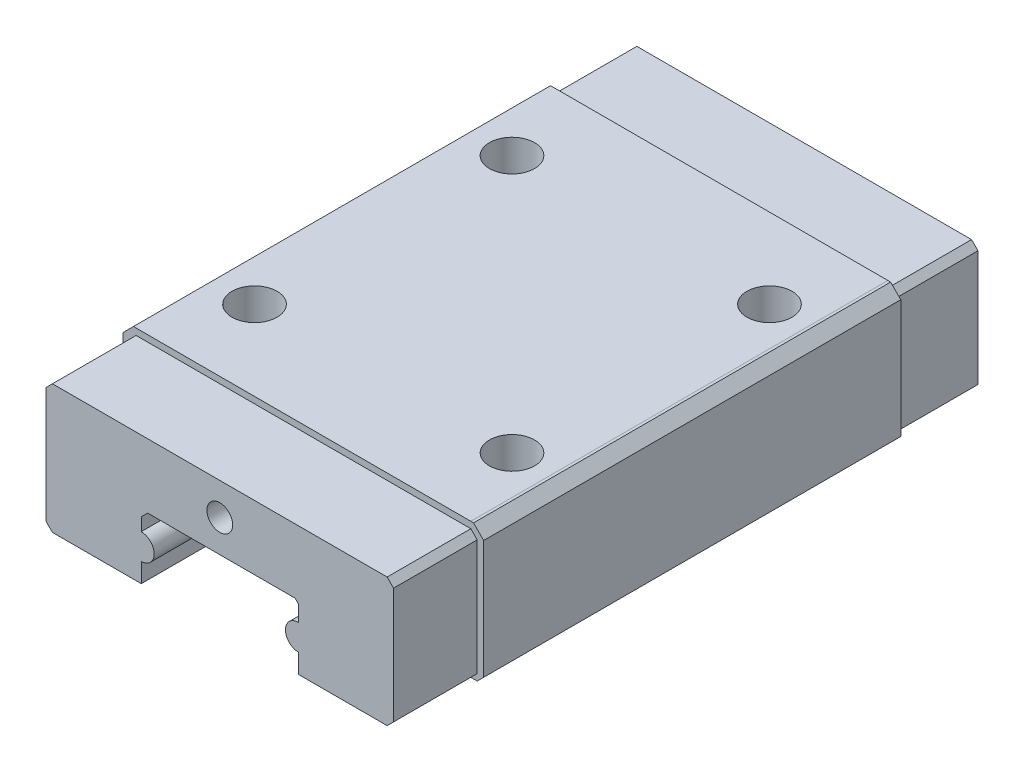
from build123d import *
from build123d.topology import SkipClean

# Parameters (mm, degrees)
SKETCH1_R                 = 1
BOSS_EXTRUDE1_DEPTH       = 45.4
BOSS_EXTRUDE2_START       = -38.9
SKETCH5_R                 = 1
BOSS_EXTRUDE2_DEPTH       = 32.4
M5X0_8_TAPPED_HOLE1_D     = 3.5
M5X0_8_TAPPED_HOLE1_DEPTH = 4
M5X0_8_TAPPED_HOLE1_TIP   = 1.051506083


with BuildPart() as part:
    # Sketch1 → Boss-Extrude1 (new body)
    with BuildSketch(Plane.XY):
        with BuildLine():
            Line((-13.5, -4.5), (-13, -5))
            Line((-13, -5), (-6.1, -5))
            Line((-6.1, -5), (-6.1, -3.5))
            ThreePointArc((-6.1, -3.5), (-5.1, -2.5), (-6.1, -1.5))
            Line((-6.1, -1.5), (-6.1, -0.5))
            Line((-6.1, -0.5), (-5.6, 0))
            Line((-5.6, 0), (5.85, 0))
            Line((5.85, 0), (6.1, -0.25))
            Line((6.1, -0.25), (6.1, -1.5))
            ThreePointArc((6.1, -1.5), (5.1, -2.5), (6.1, -3.5))
            Line((6.1, -3.5), (6.1, -5))
            Line((6.1, -5), (13, -5))
            Line((13, -5), (13.5, -4.5))
            Line((13.5, -4.5), (13.5, 4.5))
            Line((13.5, 4.5), (13, 5))
            Line((13, 5), (-13, 5))
            Line((-13, 5), (-13.5, 4.5))
            Line((-13.5, 4.5), (-13.5, -4.5))
        make_face()
        with Locations((0, 2.5)):
            Circle(SKETCH1_R, mode=Mode.SUBTRACT)
    extrude(amount=BOSS_EXTRUDE1_DEPTH)

    # Sketch5 → Boss-Extrude2 (add)
    with SkipClean():  # the faces are left unmerged after this step: merging them gives an invalid solid
        with BuildSketch(Plane.XY.offset(45.4).offset(BOSS_EXTRUDE2_START)):
            with BuildLine():
                Line((13, 5.5), (13.210808273, 5.496298508))
                Line((13.210808273, 5.496298508), (13.353553391, 5.353553391))
                Line((13.353553391, 5.353553391), (14, 4.707106781))
                Line((14, 4.707106781), (14, -4.5))
                Line((14, -4.5), (13.5, -5))
                Line((13.5, -5), (6.1, -5))
                Line((6.1, -5), (6.1, -3.5))
                ThreePointArc((6.1, -3.5), (5.1, -2.5), (6.1, -1.5))
                Line((6.1, -1.5), (6.1, -0.25))
                Line((6.1, -0.25), (5.85, 0))
                Line((5.85, 0), (-5.6, 0))
                Line((-5.6, 0), (-6.1, -0.5))
                Line((-6.1, -0.5), (-6.1, -1.5))
                ThreePointArc((-6.1, -1.5), (-5.1, -2.5), (-6.1, -3.5))
                Line((-6.1, -3.5), (-6.1, -5))
                Line((-6.1, -5), (-13.5, -5))
                Line((-13.5, -5), (-14, -4.5))
                Line((-14, -4.5), (-14, 4.5))
                Line((-14, 4.5), (-14, 4.707106781))
                Line((-14, 4.707106781), (-13.853553391, 4.853553391))
                Line((-13.853553391, 4.853553391), (-13.207106781, 5.5))
                Line((-13.207106781, 5.5), (13, 5.5))
            make_face()
            with Locations((0, 2.5)):
                Circle(SKETCH5_R, mode=Mode.SUBTRACT)
        extrude(amount=BOSS_EXTRUDE2_DEPTH)
    add(part.part.scale(1), mode=Mode.REPLACE)  # the faces are merged on a copy

    # M5x0.8 Tapped Hole1
    with Locations(Plane(origin=(0, 5.5, 0), x_dir=(1, 0, 0), z_dir=(0, 1, 0))):
        with Locations((-10, -12.7), (-10, -32.7), (10, -32.7), (10, -12.7)):
            Hole(M5X0_8_TAPPED_HOLE1_D / 2, depth=M5X0_8_TAPPED_HOLE1_DEPTH)
            with Locations((0, 0, -(M5X0_8_TAPPED_HOLE1_DEPTH + M5X0_8_TAPPED_HOLE1_TIP / 2))):  # 118° drill point
                Cone(0, M5X0_8_TAPPED_HOLE1_D / 2, M5X0_8_TAPPED_HOLE1_TIP, mode=Mode.SUBTRACT)


solid = part.part
